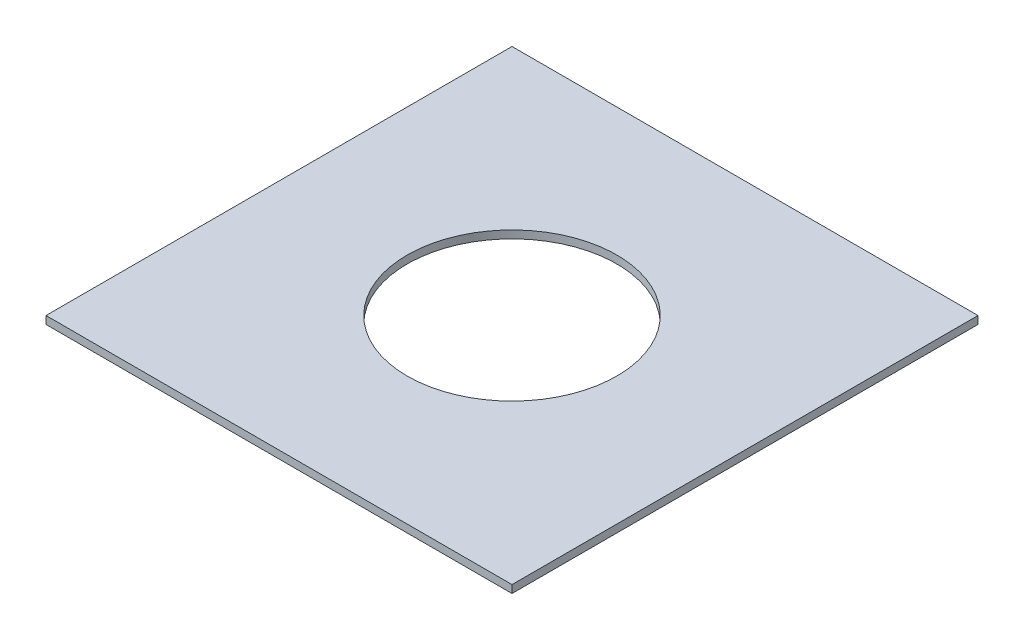
from build123d import *

# Parameters (mm, degrees)
SKETCH1_W           = 60
SKETCH1_H           = 60
SKETCH1_R           = 13.5
BOSS_EXTRUDE1_DEPTH = 1


with BuildPart() as part:
    # Sketch1 → Boss-Extrude1 (new body)
    with BuildSketch(Plane(origin=(0, 0, 0), x_dir=(1, 0, 0), z_dir=(0, 1, 0))):
        with Locations((-4.502756167, 7.71999418)):
            Rectangle(SKETCH1_W, SKETCH1_H)
        with Locations((-4.502756167, 7.71999418)):
            Circle(SKETCH1_R, mode=Mode.SUBTRACT)
    extrude(amount=BOSS_EXTRUDE1_DEPTH)


solid = part.part
